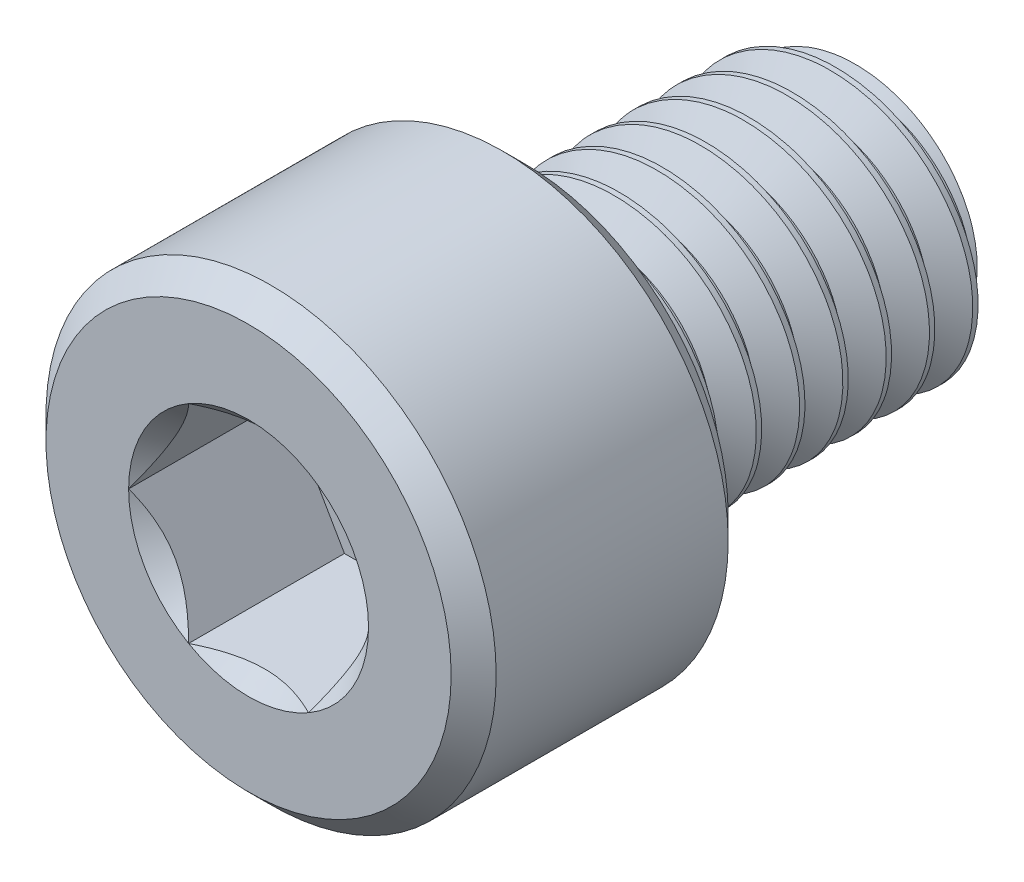
from build123d import *

# Parameters (mm, degrees)
SKETCH1_R           = 4
BOSS_EXTRUDE1_DEPTH = 10
CUT_SWEEP1_PITCH    = 1.25
SKETCH5_R           = 6.5
BOSS_EXTRUDE2_DEPTH = 8
CUT_EXTRUDE1_DEPTH  = 4.5
CHAMFER1_SIZE       = 0.65


with BuildPart() as part:
    # Sketch1 → Boss-Extrude1 (new body)
    with BuildSketch(Plane.XY):
        Circle(SKETCH1_R)
    extrude(amount=BOSS_EXTRUDE1_DEPTH)

    # Cut-Sweep1: the profile of Sketch3 screwed along a right-hand helix of 36 turns, 8 arcs to a turn; built about Z, then put on its axis
    cut_sweep1_z = Axis((0, 0, 0), (0, 0, 1))
    cut_sweep1_corners = [(4, 0, 0), (4, 0.054343923, -1.092649412), (3.187668171, 0.031046574, -0.624228412), (3.187668171, 0.023297349, -0.468421)]
    with BuildLine(mode=Mode.PRIVATE) as cut_sweep1_profile:
        Line(cut_sweep1_corners[0], cut_sweep1_corners[1])
        Line(cut_sweep1_corners[1], cut_sweep1_corners[2])
        Line(cut_sweep1_corners[2], cut_sweep1_corners[3])
        Line(cut_sweep1_corners[3], cut_sweep1_corners[0])
    cut_sweep1_cap = Face(cut_sweep1_profile.wire())
    cut_sweep1_turn_angles = [0, 22.5, 45, 67.5, 90, 112.5, 135, 157.5, 180, 202.5, 225, 247.5, 270, 292.5, 315, 337.5, 360]
    cut_sweep1_turn_weights = [1, 0.9238795325112867, 1, 0.9238795325112867, 1, 0.9238795325112867, 1, 0.9238795325112867, 1, 0.9238795325112867, 1, 0.9238795325112867, 1, 0.9238795325112867, 1, 0.9238795325112867, 1]
    cut_sweep1_turn_rails = [Edge.make_bspline([Vector(p[0], p[1], 0).rotate(cut_sweep1_z, cut_sweep1_turn_angles[k]) / cut_sweep1_turn_weights[k] + Vector(0, 0, p[2] + CUT_SWEEP1_PITCH * cut_sweep1_turn_angles[k] / 360) for k in range(17)], [0, 0, 0, 1, 1, 2, 2, 3, 3, 4, 4, 5, 5, 6, 6, 7, 7, 8, 8, 8], 2, cut_sweep1_turn_weights) for p in cut_sweep1_corners]
    cut_sweep1_turn_sides = [Face.make_surface_from_curves(cut_sweep1_turn_rails[p[0]], cut_sweep1_turn_rails[p[1]]) for p in [(0, 1), (1, 2), (2, 3), (3, 0)]]
    cut_sweep1 = Plane(origin=(0, 0, 0), x_dir=(0, 1, 0), z_dir=(0, 0, 1)) * Solid(Shell([*[p.moved(Location((0, 0, CUT_SWEEP1_PITCH * i))) for i in range(36) for p in cut_sweep1_turn_sides], cut_sweep1_cap, cut_sweep1_cap.rotate(cut_sweep1_z, 12960).moved(Location((0, 0, CUT_SWEEP1_PITCH * 12960 / 360)))]))
    add(cut_sweep1, mode=Mode.SUBTRACT)

    # Sketch4 → Cut-Revolve1 (revolve, cut)
    with BuildSketch(Plane(origin=(0, 0, 0), x_dir=(0, 0, -1), z_dir=(1, 0, 0)), mode=Mode.PRIVATE) as cut_revolve1_sk:
        Polygon((0, 5), (-1.446861123, 5), (0, 2.933668171), align=None)
    revolve(cut_revolve1_sk.sketch.rotate(Axis((0, 0, 0), (0, 0, -1)), 90), axis=Axis((0, 0, 0), (0, 0, -1)), mode=Mode.SUBTRACT)

    # Sketch5 → Boss-Extrude2 (add)
    with BuildSketch(Plane.XY.offset(10)):
        Circle(SKETCH5_R)
    extrude(amount=BOSS_EXTRUDE2_DEPTH)

    # Sketch6 → Cut-Extrude1 (cut)
    with BuildSketch(Plane.XY.offset(18)):
        Polygon((1.732050808, 3), (-1.732050808, 3), (-3.464101615, 0), (-1.732050808, -3), (1.732050808, -3), (3.464101615, 0), align=None)
    extrude(amount=-CUT_EXTRUDE1_DEPTH, mode=Mode.SUBTRACT)

    # Cut-Extrude2 cone 1 section (through the dimple's axis) → Cut-Extrude2 (revolve, cut)
    with BuildSketch(Plane(origin=(0, 0, 18), x_dir=(0, -1, 0), z_dir=(1, 0, 0))):
        Polygon((0, 0), (3.464101615, 0), (0, 3.464101615), align=None)
    revolve(axis=Axis((0, 0, 18), (0, 0, -1)), mode=Mode.SUBTRACT)

    # Chamfer1
    chamfer1_edges = [part.edges().sort_by_distance(p)[0] for p in [
        (-6.5, 0, 10),
        (-6.5, 0, 18),
    ]]
    chamfer(chamfer1_edges, length=CHAMFER1_SIZE)


solid = part.part
